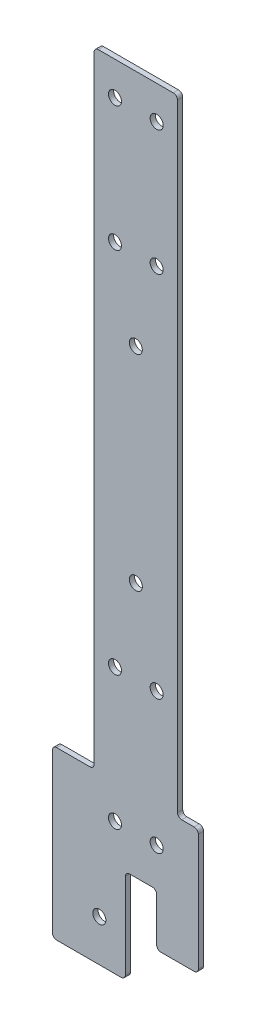
from build123d import *

# Parameters (mm, degrees)
BOSS_EXTRUDE1_OUTLINE_R = 3.96875
BOSS_EXTRUDE1_DEPTH     = 3.175
FILLET2_R               = 2.54


# Read off the part's stored shape, not the designer's step: Boss-Extrude1
with BuildPart() as part:
    # Boss-Extrude1 outline → Boss-Extrude1 (new body)
    with BuildSketch(Plane.XY):
        Polygon((25.4, 0), (-25.4, 0), (-25.4, -381), (-50.8, -381), (-50.8, -482.6), (-6.35, -482.6), (-6.35, -425.45), (12.7, -425.45), (12.7, -457.2), (38.1, -457.2), (38.1, -381), (25.4, -381), align=None)
        with Locations((-22.225, -457.2)):
            Circle(BOSS_EXTRUDE1_OUTLINE_R, mode=Mode.SUBTRACT)
        with Locations((-12.7, -402.082)):
            Circle(BOSS_EXTRUDE1_OUTLINE_R, mode=Mode.SUBTRACT)
        with Locations((-12.7, -320.675)):
            Circle(BOSS_EXTRUDE1_OUTLINE_R, mode=Mode.SUBTRACT)
        with Locations((12.7, -402.082)):
            Circle(BOSS_EXTRUDE1_OUTLINE_R, mode=Mode.SUBTRACT)
        with Locations((12.7, -320.675)):
            Circle(BOSS_EXTRUDE1_OUTLINE_R, mode=Mode.SUBTRACT)
        with Locations((0, -270.0655)):
            Circle(BOSS_EXTRUDE1_OUTLINE_R, mode=Mode.SUBTRACT)
        with Locations((-12.7, -96.52)):
            Circle(BOSS_EXTRUDE1_OUTLINE_R, mode=Mode.SUBTRACT)
        with Locations((-12.7, -20.32)):
            Circle(BOSS_EXTRUDE1_OUTLINE_R, mode=Mode.SUBTRACT)
        with Locations((0, -145.0975)):
            Circle(BOSS_EXTRUDE1_OUTLINE_R, mode=Mode.SUBTRACT)
        with Locations((12.7, -96.52)):
            Circle(BOSS_EXTRUDE1_OUTLINE_R, mode=Mode.SUBTRACT)
        with Locations((12.7, -20.32)):
            Circle(BOSS_EXTRUDE1_OUTLINE_R, mode=Mode.SUBTRACT)
    extrude(amount=BOSS_EXTRUDE1_DEPTH)

    # Fillet2
    fillet2_edges = [part.edges().sort_by_distance(p)[0] for p in [
        (25.4, 0, 1.5875),
        (25.4, -381, 1.5875),
        (38.1, -381, 1.5875),
        (38.1, -457.2, 1.5875),
        (12.7, -457.2, 1.5875),
        (12.7, -425.45, 1.5875),
        (-6.35, -425.45, 1.5875),
        (-6.35, -482.6, 1.5875),
        (-50.8, -482.6, 1.5875),
        (-50.8, -381, 1.5875),
        (-25.4, -381, 1.5875),
        (-25.4, 0, 1.5875),
    ]]
    fillet(fillet2_edges, radius=FILLET2_R)


solid = part.part
